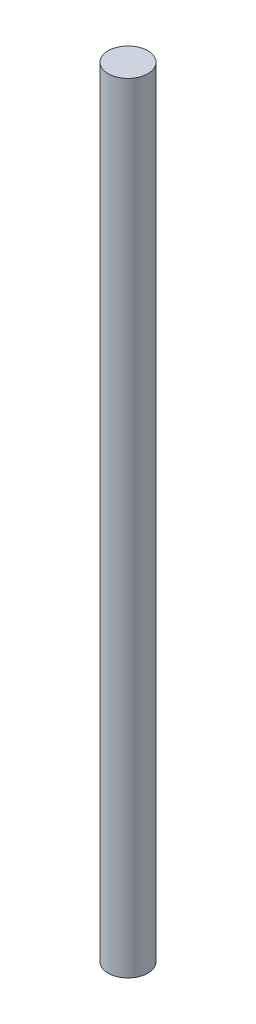
from build123d import *

# Parameters (mm, degrees)
SKETCH1_R           = 3.175
BOSS_EXTRUDE1_DEPTH = 124.46


with BuildPart() as part:
    # Sketch1 → Boss-Extrude1 (new body)
    with BuildSketch(Plane(origin=(0, 0, 0), x_dir=(1, 0, 0), z_dir=(0, 1, 0))):
        Circle(SKETCH1_R)
    extrude(amount=BOSS_EXTRUDE1_DEPTH)


solid = part.part
